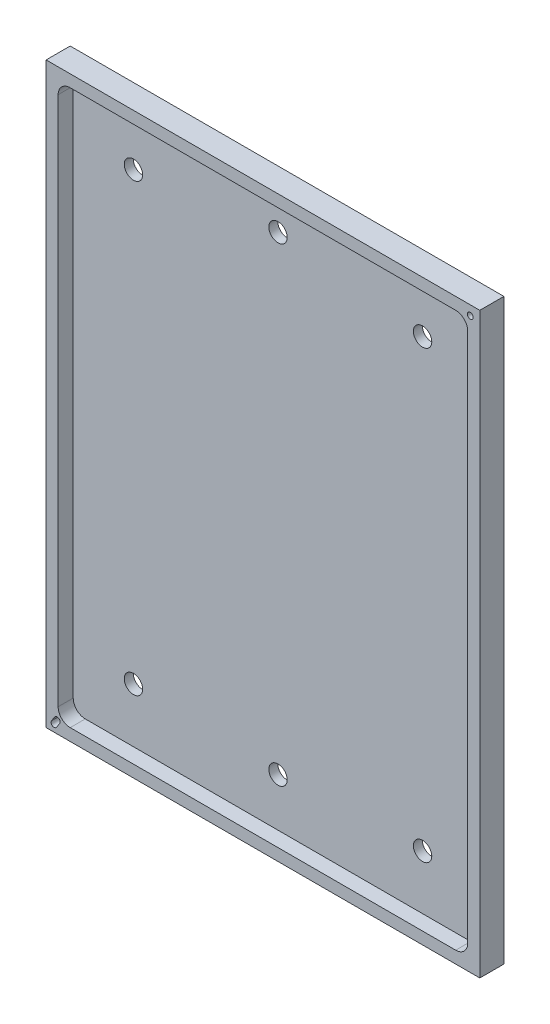
from build123d import *

# Parameters (mm, degrees)
SKETCH1_W                      = 228.6
SKETCH1_H                      = 304.8
BOSS_EXTRUDE1_DEPTH            = 12.7
CUT_EXTRUDE1_DEPTH             = 7.9375
SKETCH4_R                      = 4.85
CUT_EXTRUDE2_DEPTH             = 191.665292873
F_3_1_3_1_DIAMETER_HOLE1_D     = 3.1
F_3_1_3_1_DIAMETER_HOLE1_DEPTH = 5
F_3_1_3_1_DIAMETER_HOLE1_TIP   = 0.931333959
CUT_EXTRUDE3_DEPTH             = 5
M4X0_7_TAPPED_HOLE1_D          = 3.3
M4X0_7_TAPPED_HOLE1_DEPTH      = 5.4
M4X0_7_TAPPED_HOLE1_TIP        = 0.991420021


with BuildPart() as part:
    # Sketch1 → Boss-Extrude1 (new body)
    with BuildSketch(Plane.XY):
        Rectangle(SKETCH1_W, SKETCH1_H)
    extrude(amount=BOSS_EXTRUDE1_DEPTH)

    # Sketch2 → Cut-Extrude1 (cut)
    with BuildSketch(Plane.XY.offset(12.7)):
        with BuildLine():
            Line((101.6, -146.05), (-101.6, -146.05))
            ThreePointArc((-101.6, -146.05), (-106.090128061, -144.190128061), (-107.95, -139.7))
            Line((-107.95, -139.7), (-107.95, 139.7))
            ThreePointArc((-107.95, 139.7), (-106.090128061, 144.190128061), (-101.6, 146.05))
            Line((-101.6, 146.05), (101.6, 146.05))
            ThreePointArc((101.6, 146.05), (106.090128061, 144.190128061), (107.95, 139.7))
            Line((107.95, 139.7), (107.95, -139.7))
            ThreePointArc((107.95, -139.7), (106.090128061, -144.190128061), (101.6, -146.05))
        make_face()
    extrude(amount=-CUT_EXTRUDE1_DEPTH, mode=Mode.SUBTRACT)

    # Sketch4 → Cut-Extrude2 (cut, through all)
    with BuildSketch(Plane.XY.offset(4.7625)):
        with Locations((-76.2, 117.4)):
            Circle(SKETCH4_R)
        with Locations((76.2, 117.4)):
            Circle(SKETCH4_R)
        with Locations((-76.2, -117.4)):
            Circle(SKETCH4_R)
        with Locations((76.2, -117.4)):
            Circle(SKETCH4_R)
        with Locations((0, 126.925)):
            Circle(SKETCH4_R)
        with Locations((0, -120.65)):
            Circle(SKETCH4_R)
    extrude(amount=-CUT_EXTRUDE2_DEPTH, mode=Mode.SUBTRACT)

    # Ø3.1 (3.1) Diameter Hole1
    with Locations(Plane.XY.offset(12.7)):
        with Locations((109.3, 147.4)):
            Hole(F_3_1_3_1_DIAMETER_HOLE1_D / 2, depth=F_3_1_3_1_DIAMETER_HOLE1_DEPTH)
            with Locations((0, 0, -(F_3_1_3_1_DIAMETER_HOLE1_DEPTH + F_3_1_3_1_DIAMETER_HOLE1_TIP / 2))):  # 118° drill point
                Cone(0, F_3_1_3_1_DIAMETER_HOLE1_D / 2, F_3_1_3_1_DIAMETER_HOLE1_TIP, mode=Mode.SUBTRACT)

    # Sketch7 → Cut-Extrude3 (cut)
    with BuildSketch(Plane.XY.offset(12.7)):
        with BuildLine():
            Line((-111.420428502, -147.795326406), (-109.764617546, -145.29366894))
            ThreePointArc((-109.764617546, -145.29366894), (-107.616592195, -144.856648243), (-107.179571498, -147.004673594))
            Line((-107.179571498, -147.004673594), (-108.835382454, -149.50633106))
            ThreePointArc((-108.835382454, -149.50633106), (-110.983407805, -149.943351757), (-111.420428502, -147.795326406))
        make_face()
    extrude(amount=-CUT_EXTRUDE3_DEPTH, mode=Mode.SUBTRACT)

    # M4x0.7 Tapped Hole1
    with Locations(Plane(origin=(0, 0, 0), x_dir=(-1, 0, 0), z_dir=(0, 0, -1))):
        with Locations((-111.125, -102.4), (-111.125, 0), (-111.125, 113.6)):
            Hole(M4X0_7_TAPPED_HOLE1_D / 2, depth=M4X0_7_TAPPED_HOLE1_DEPTH)
            with Locations((0, 0, -(M4X0_7_TAPPED_HOLE1_DEPTH + M4X0_7_TAPPED_HOLE1_TIP / 2))):  # 118° drill point
                Cone(0, M4X0_7_TAPPED_HOLE1_D / 2, M4X0_7_TAPPED_HOLE1_TIP, mode=Mode.SUBTRACT)


solid = part.part
